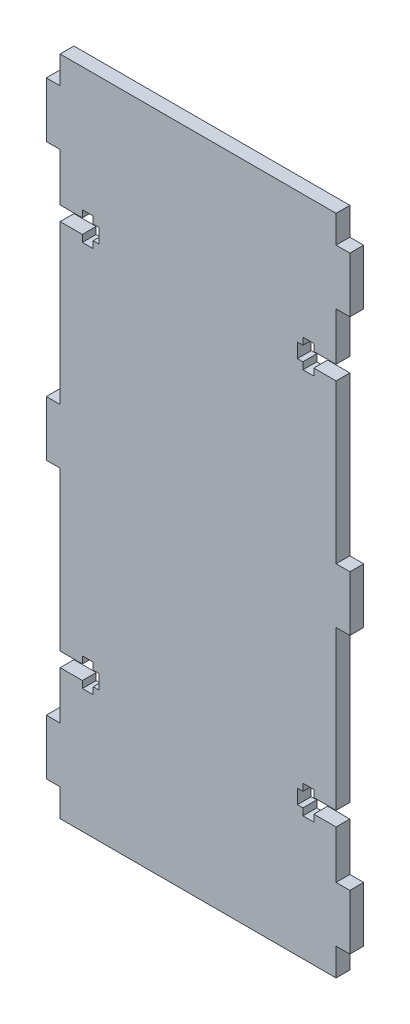
from build123d import *

# Parameters (mm, degrees)
SKETCH1_W           = 63.5
SKETCH1_H           = 152.4
BOSS_EXTRUDE1_DEPTH = 3.175
SKETCH2_W           = 3.175
SKETCH2_H           = 12.7
BOSS_EXTRUDE3_DEPTH = 3.175
SKETCH4_W           = 8.89
SKETCH4_H           = 3.302
SKETCH4_W_2         = 2.5
SKETCH4_H_2         = 6.5
CUT_EXTRUDE4_DEPTH  = 3.175


with BuildPart() as part:
    # Sketch1 → Boss-Extrude1 (new body)
    with BuildSketch(Plane.XY):
        with Locations((31.75, 76.2)):
            Rectangle(SKETCH1_W, SKETCH1_H)
    extrude(amount=BOSS_EXTRUDE1_DEPTH)

    # Sketch2 → Boss-Extrude3 (add)
    with BuildSketch(Plane.XY.offset(3.175)):
        with Locations((-1.5875, 139.7)):
            Rectangle(SKETCH2_W, SKETCH2_H)
        with Locations((-1.5875, 12.7)):
            Rectangle(SKETCH2_W, SKETCH2_H)
        with Locations((-1.5875, 76.2)):
            Rectangle(SKETCH2_W, SKETCH2_H)
        with Locations((65.0875, 12.7)):
            Rectangle(SKETCH2_W, SKETCH2_H)
        with Locations((65.0875, 76.2)):
            Rectangle(SKETCH2_W, SKETCH2_H)
        with Locations((65.0875, 139.7)):
            Rectangle(SKETCH2_W, SKETCH2_H)
    extrude(amount=-BOSS_EXTRUDE3_DEPTH)

    # Sketch4 → Cut-Extrude4 (cut)
    with BuildSketch(Plane.XY.offset(3.175)):
        with Locations((4.445, 120.65)):
            Rectangle(SKETCH4_W, SKETCH4_H)
        with Locations((6.37, 120.65)):
            Rectangle(SKETCH4_W_2, SKETCH4_H_2)
        with Locations((6.37, 31.75)):
            Rectangle(SKETCH4_W_2, SKETCH4_H_2)
        with Locations((4.445, 31.75)):
            Rectangle(SKETCH4_W, SKETCH4_H)
        with Locations((59.055, 31.75)):
            Rectangle(SKETCH4_W, SKETCH4_H)
        with Locations((57.13, 31.75)):
            Rectangle(SKETCH4_W_2, SKETCH4_H_2)
        with Locations((57.13, 120.65)):
            Rectangle(SKETCH4_W_2, SKETCH4_H_2)
        with Locations((59.055, 120.65)):
            Rectangle(SKETCH4_W, SKETCH4_H)
    extrude(amount=-CUT_EXTRUDE4_DEPTH, mode=Mode.SUBTRACT)


solid = part.part
